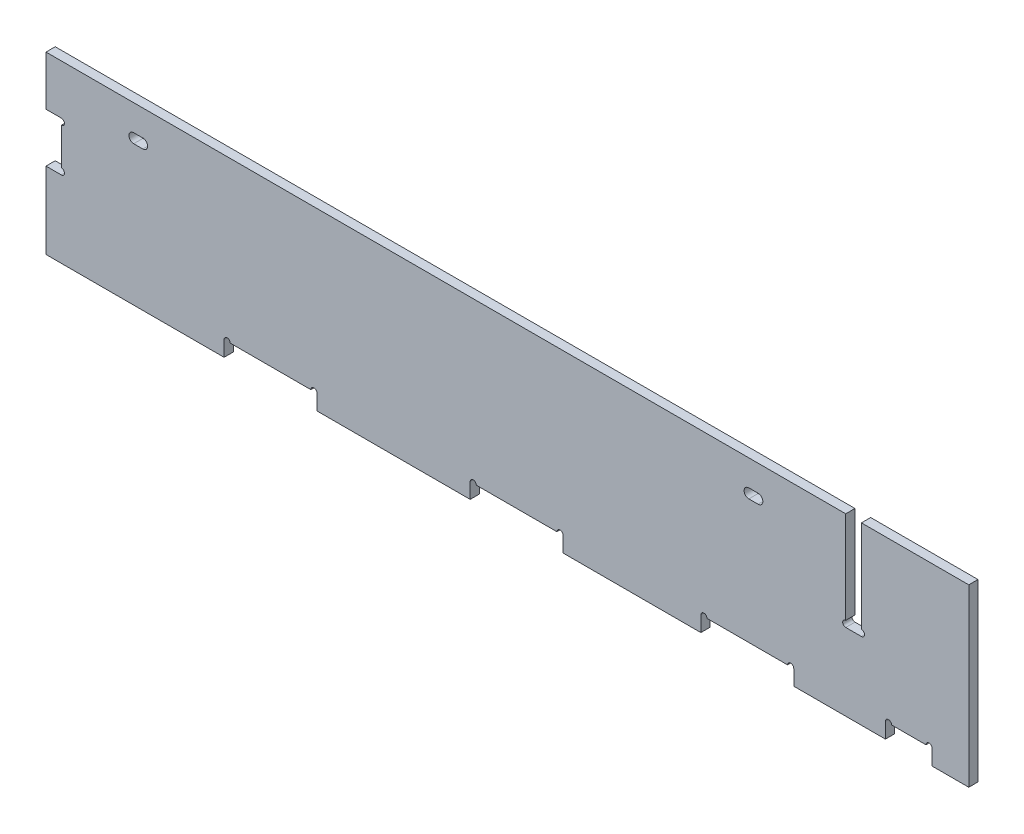
from build123d import *

# Parameters (mm, degrees)
SKETCH_1_W          = 300
SKETCH_1_H          = 57
EXTRUDE_1_DEPTH     = 3
SKETCH_2_W          = 5
SKETCH_2_H          = 16
SKETCH_2_W_2        = 30.2
SKETCH_2_H_2        = 5
SKETCH_2_W_3        = 15.2
SKETCH_2_W_4        = 5.1
SKETCH_2_H_3        = 32
CUT_EXTRUDE_1_DEPTH = 5
SKETCH_3_R          = 1
CUT_EXTRUDE_2_DEPTH = 5
CUT_EXTRUDE_6_DEPTH = 10


with BuildPart() as part:
    # 스케치1 → 보스-돌출1 (new body)
    with BuildSketch(Plane.XY):
        with Locations((150, 28.5)):
            Rectangle(SKETCH_1_W, SKETCH_1_H)
    extrude(amount=EXTRUDE_1_DEPTH)

    # 스케치2 → 컷-돌출1 (cut)
    with BuildSketch(Plane.XY.offset(3)):
        with Locations((2.5, 32.9)):
            Rectangle(SKETCH_2_W, SKETCH_2_H)
        with Locations((73, 2.5)):
            Rectangle(SKETCH_2_W_2, SKETCH_2_H_2)
        with Locations((153, 2.5)):
            Rectangle(SKETCH_2_W_2, SKETCH_2_H_2)
        with Locations((228, 2.5)):
            Rectangle(SKETCH_2_W_2, SKETCH_2_H_2)
        with Locations((280.5, 2.5)):
            Rectangle(SKETCH_2_W_3, SKETCH_2_H_2)
        with Locations((262.55, 41)):
            Rectangle(SKETCH_2_W_4, SKETCH_2_H_3)
    extrude(amount=-CUT_EXTRUDE_1_DEPTH, mode=Mode.SUBTRACT)

    # 스케치3 → 컷-돌출2 (cut)
    with BuildSketch(Plane.XY.offset(3)):
        with Locations((273.9, 5)):
            Circle(SKETCH_3_R)
        with Locations((287.1, 5)):
            Circle(SKETCH_3_R)
        with Locations((260, 26)):
            Circle(SKETCH_3_R)
        with Locations((265.1, 26)):
            Circle(SKETCH_3_R)
        with Locations((213.9, 5)):
            Circle(SKETCH_3_R)
        with Locations((242.1, 5)):
            Circle(SKETCH_3_R)
        with Locations((87.1, 5)):
            Circle(SKETCH_3_R)
        with Locations((138.9, 5)):
            Circle(SKETCH_3_R)
        with Locations((167.1, 5)):
            Circle(SKETCH_3_R)
        with Locations((5, 25.9)):
            Circle(SKETCH_3_R)
        with Locations((5, 39.9)):
            Circle(SKETCH_3_R)
        with Locations((58.9, 5)):
            Circle(SKETCH_3_R)
    extrude(amount=-CUT_EXTRUDE_2_DEPTH, mode=Mode.SUBTRACT)

    # 스케치8 → 컷-돌출6 (cut)
    with BuildSketch(Plane.XY.offset(3)):
        with BuildLine():
            Line((28.5, 48.55), (31.5, 48.55))
            ThreePointArc((31.5, 48.55), (33.05, 47), (31.5, 45.45))
            Line((31.5, 45.45), (28.5, 45.45))
            ThreePointArc((28.5, 45.45), (26.95, 47), (28.5, 48.55))
        make_face()
        with BuildLine():
            Line((228.5, 48.55), (231.5, 48.55))
            ThreePointArc((231.5, 48.55), (233.05, 47), (231.5, 45.45))
            Line((231.5, 45.45), (228.5, 45.45))
            ThreePointArc((228.5, 45.45), (226.95, 47), (228.5, 48.55))
        make_face()
    extrude(amount=-CUT_EXTRUDE_6_DEPTH, mode=Mode.SUBTRACT)


solid = part.part
